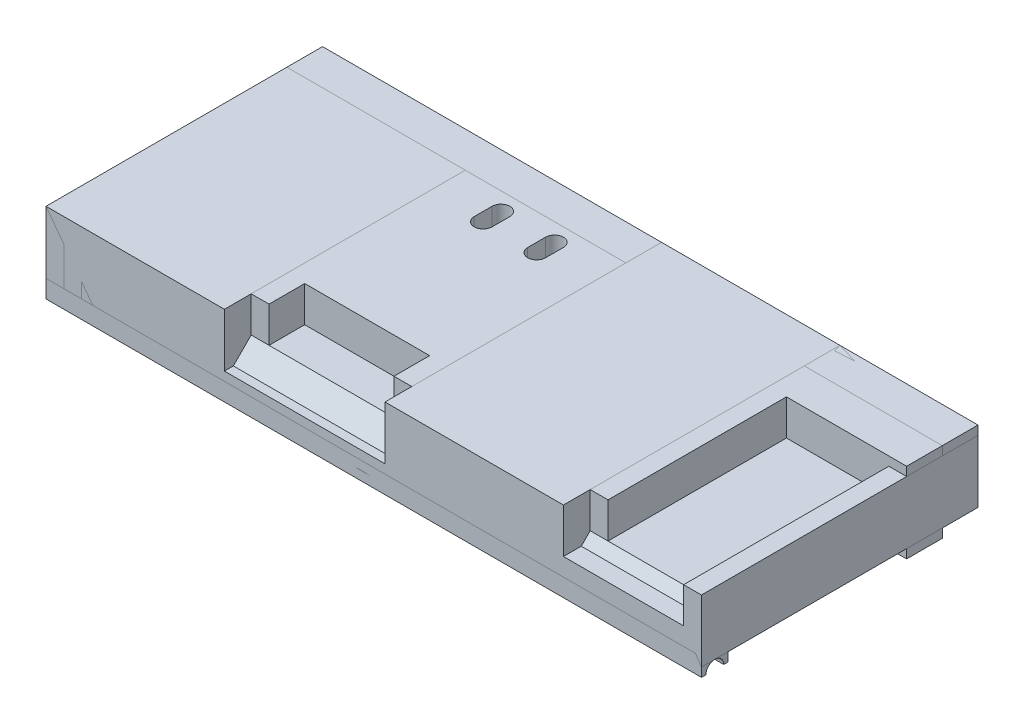
from build123d import *

# Parameters (mm, degrees)
BOSS_EXTRUDE1_DEPTH      = 6.35
BOSS_EXTRUDE1_DEPTH_BACK = 0.79375
BOSS_EXTRUDE2_DEPTH      = 2.38125
BOSS_EXTRUDE2_DEPTH_BACK = 22.225
BOSS_EXTRUDE3_DEPTH      = 58.3184


with BuildPart() as part:
    # Sketch1 → Boss-Extrude1 (new, two sides: drawn at the far end of the back side and taken through both)
    with BuildSketch(Plane(origin=(0, 0, 0), x_dir=(1, 0, 0), z_dir=(0, 1, 0)).offset(-BOSS_EXTRUDE1_DEPTH_BACK)):
        Polygon((0, -2.38125), (0, 22.225), (46.0375, 22.225), (56.7309, 19.05), (58.3184, 19.05), (58.3184, 15.875), (47.625, 15.875), (47.625, 0), (28.575, 0), (28.575, 3.175), (17.4625, 3.175), (17.4625, 0), (4.7625, 0), (4.7625, -2.38125), (3.175, -2.38125), (3.175, 0), (1.5875, 0), (1.5875, -2.38125), align=None)
        with BuildLine():
            Line((19.84375, 17.4625), (19.84375, 15.875))
            ThreePointArc((19.84375, 15.875), (20.6375, 15.08125), (21.43125, 15.875))
            Line((21.43125, 15.875), (21.43125, 17.4625))
            ThreePointArc((21.43125, 17.4625), (20.6375, 18.25625), (19.84375, 17.4625))
        make_face(mode=Mode.SUBTRACT)
        with BuildLine():
            Line((26.19375, 17.4625), (26.19375, 15.875))
            ThreePointArc((26.19375, 15.875), (25.4, 15.08125), (24.60625, 15.875))
            Line((24.60625, 15.875), (24.60625, 17.4625))
            ThreePointArc((24.60625, 17.4625), (25.4, 18.25625), (26.19375, 17.4625))
        make_face(mode=Mode.SUBTRACT)
    extrude(amount=BOSS_EXTRUDE1_DEPTH + BOSS_EXTRUDE1_DEPTH_BACK)


with BuildPart() as body_2:
    # Sketch2 → Boss-Extrude2 (new, two sides: drawn at the far end of the back side and taken through both)
    with BuildSketch(Plane.XY.offset(-BOSS_EXTRUDE2_DEPTH_BACK)):
        Polygon((0, -0.79375), (0, 6.35), (15.875, 6.35), (15.875, 1.5875), (30.1625, 1.5875), (30.1625, 6.35), (46.0375, 6.35), (46.0375, 2.38125), (56.7309, 2.38125), (56.7309, 5.55625), (58.3184, 5.55625), (58.3184, 0), (4.7625, 0), (4.7625, -0.79375), (3.175, -0.79375), (3.175, 0), (1.5875, 0), (1.5875, -0.79375), align=None)
    extrude(amount=BOSS_EXTRUDE2_DEPTH + BOSS_EXTRUDE2_DEPTH_BACK)


with BuildPart() as body_3:
    # Sketch3 → Boss-Extrude3 (new body)
    with BuildSketch(Plane(origin=(0, 0, 0), x_dir=(0, 0, -1), z_dir=(1, 0, 0))):
        with BuildLine():
            Line((0, 3.175), (20.6375, 3.175))
            Line((20.6375, 3.175), (20.6375, 4.7625))
            Line((20.6375, 4.7625), (19.05, 5.340302747))
            Line((19.05, 5.340302747), (19.05, 6.35))
            Line((19.05, 6.35), (22.225, 6.35))
            Line((22.225, 6.35), (22.225, 0))
            Line((22.225, 0), (0, 0))
            Line((0, 0), (0, -0.79375))
            Line((0, -0.79375), (-0.396875, -0.79375))
            ThreePointArc((-0.396875, -0.79375), (-1.190625, 0), (-1.984375, -0.79375))
            Line((-1.984375, -0.79375), (-2.38125, -0.79375))
            Line((-2.38125, -0.79375), (-2.38125, 0.79375))
            Line((-2.38125, 0.79375), (0, 3.175))
        make_face()
    extrude(amount=BOSS_EXTRUDE3_DEPTH)


solid = Compound([part.part, body_2.part, body_3.part])
